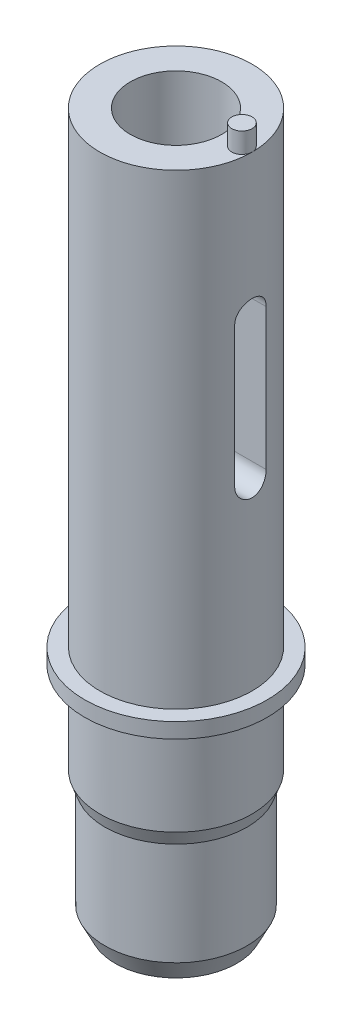
from build123d import *

# Parameters (mm, degrees)
SKETCH6_R                  = 1
BOSS_EXTRUDE1_DEPTH        = 2
CUT_EXTRUDE1_DEPTH         = 72.147733625
CUT_EXTRUDE1_DEPTH_BACK    = 72.147733625
M10X1_0_TAPPED_HOLE1_D     = 9
M10X1_0_TAPPED_HOLE1_DEPTH = 9
M10X1_0_TAPPED_HOLE1_TIP   = 2.703872786
CHAMFER1_SIZE              = 2
CHAMFER1_SIZE2             = 1
CHAMFER2_SIZE2             = 0.5
CHAMFER2_SIZE              = 1.37373871


with BuildPart() as part:
    # Sketch1 → Revolve1 (revolve)
    with BuildSketch(Plane.XY, mode=Mode.PRIVATE) as revolve1_sk:
        Polygon((7.5, 0), (7.5, -46), (9, -46), (9, -47.5), (7.5, -47.5), (7.5, -56.5), (7, -56.5), (7, -70), (3.35, -70), (3.35, 0), align=None)
    revolve(revolve1_sk.sketch.rotate(Axis((0, -80.784886464, 0), (0, 1, 0)), 90), axis=Axis((0, -80.784886464, 0), (0, 1, 0)))

    # Sketch6 → Boss-Extrude1 (add)
    with BuildSketch(Plane(origin=(0, 0, 0), x_dir=(1, 0, 0), z_dir=(0, 1, 0))):
        with Locations(Location((6.499, 0, 0), (0, 0, 270))):
            Circle(SKETCH6_R)
    extrude(amount=BOSS_EXTRUDE1_DEPTH)

    # Sketch2 → Cut-Revolve1 (revolve, cut)
    with BuildSketch(Plane.XY, mode=Mode.PRIVATE) as cut_revolve1_sk:
        Polygon((-3.35, 0), (-4.25, 0), (-4.25, -30), (-4, -30), (-4, -40), (-3.35, -40), align=None)
    revolve(cut_revolve1_sk.sketch.rotate(Axis((0, -73.381951652, 0), (0, 1, 0)), 270), axis=Axis((0, -73.381951652, 0), (0, 1, 0)), mode=Mode.SUBTRACT)

    # Sketch3 → Cut-Extrude1 (cut, two sides: drawn at the far end of the back side and taken through both)
    with BuildSketch(Plane(origin=(0, 0, 0), x_dir=(0, 0, -1), z_dir=(1, 0, 0)).offset(-CUT_EXTRUDE1_DEPTH_BACK)):
        with BuildLine():
            Line((-1.55, -27.95), (-1.55, -14.05))
            ThreePointArc((-1.55, -14.05), (0, -12.5), (1.55, -14.05))
            Line((1.55, -14.05), (1.55, -27.95))
            ThreePointArc((1.55, -27.95), (0, -29.5), (-1.55, -27.95))
        make_face()
    extrude(amount=CUT_EXTRUDE1_DEPTH + CUT_EXTRUDE1_DEPTH_BACK, mode=Mode.SUBTRACT)

    # M10x1.0 Tapped Hole1
    with Locations(Plane(origin=(0, 0, 0), x_dir=(-1, 0, 0), z_dir=(0, 1, 0))):
        with Locations((0, 0)):
            Hole(M10X1_0_TAPPED_HOLE1_D / 2, depth=M10X1_0_TAPPED_HOLE1_DEPTH)
            with Locations((0, 0, -(M10X1_0_TAPPED_HOLE1_DEPTH + M10X1_0_TAPPED_HOLE1_TIP / 2))):  # 118° drill point
                Cone(0, M10X1_0_TAPPED_HOLE1_D / 2, M10X1_0_TAPPED_HOLE1_TIP, mode=Mode.SUBTRACT)

    # Chamfer1
    chamfer1_edges = [part.edges().sort_by_distance(p)[0] for p in [
        (0, -70, 7),
    ]]
    chamfer1_side = [part.faces().sort_by_distance(p)[0] for p in [
        (0, -63.25, 7),
    ]]
    chamfer(chamfer1_edges, length=CHAMFER1_SIZE, length2=CHAMFER1_SIZE2, reference=chamfer1_side[0])

    # Chamfer2
    chamfer2_edges = [part.edges().sort_by_distance(p)[0] for p in [
        (0, -56.5, 7),
    ]]
    chamfer2_side = [part.faces().sort_by_distance(p)[0] for p in [
        (0, -56.51, 7),
    ]]
    chamfer(chamfer2_edges, length=CHAMFER2_SIZE - 0.0001, length2=CHAMFER2_SIZE2 - 0.0001, reference=chamfer2_side[0])  # a hair under: the kernel refuses the full size


solid = part.part
